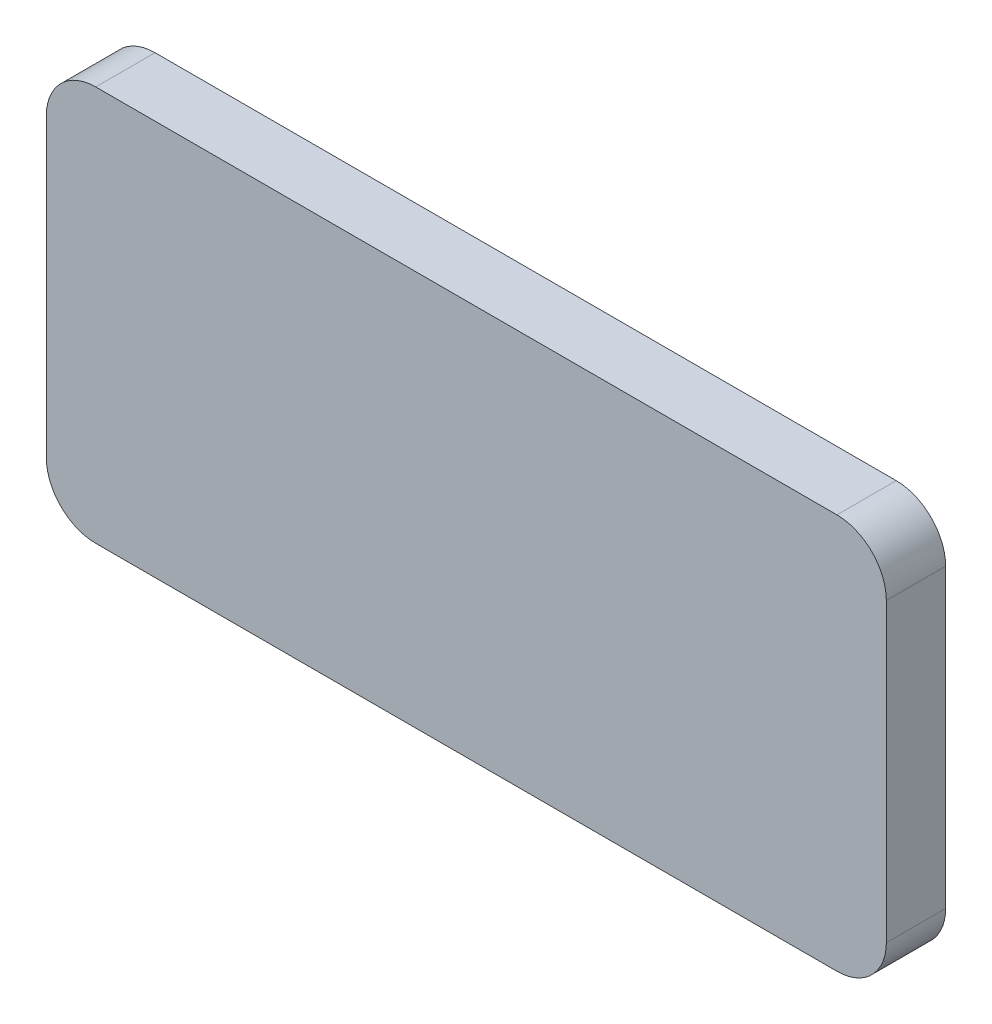
from build123d import *

# Parameters (mm, degrees)
ESQUISSE1_W                     = 85
ESQUISSE1_H                     = 40
BOSS_EXTRU_1_DEPTH              = 6
CONG_1_R                        = 5
ESQUISSE2_R                     = 4.5
BOSS_EXTRU_2_DEPTH              = 1
R_P_TITION_LIN_AIRE1_COUNT      = 7
R_P_TITION_LIN_AIRE1_PITCH      = 11
R_P_TITION_LIN_AIRE1_COUNT_DIR2 = 3
R_P_TITION_LIN_AIRE1_PITCH_DIR2 = 11
CONG_2_R                        = 5


with BuildPart() as part:
    # Esquisse1 → Boss.-Extru.1 (new body)
    with BuildSketch(Plane.XY):
        with Locations((42.5, 20)):
            Rectangle(ESQUISSE1_W, ESQUISSE1_H)
    extrude(amount=BOSS_EXTRU_1_DEPTH)

    # Congé1
    cong_1_edges = [part.edges().sort_by_distance(p)[0] for p in [
        (0, 40, 3),
        (85, 40, 3),
        (85, 0, 3),
        (0, 0, 3),
    ]]
    fillet(cong_1_edges, radius=CONG_1_R)

    # Esquisse2 → Boss.-Extru.2 (add)
    with BuildSketch(Plane(origin=(0, 0, 0), x_dir=(-1, 0, 0), z_dir=(0, 0, -1))):
        with Locations((-9, 31)):
            Circle(ESQUISSE2_R)
    boss_extru_2 = extrude(amount=BOSS_EXTRU_2_DEPTH)

    # Répétition linéaire1: Boss.-Extru.2 7 × 3
    with Locations(*[(i * R_P_TITION_LIN_AIRE1_PITCH, -j * R_P_TITION_LIN_AIRE1_PITCH_DIR2, 0) for i in range(R_P_TITION_LIN_AIRE1_COUNT) for j in range(R_P_TITION_LIN_AIRE1_COUNT_DIR2) if (i, j) != (0, 0)]):
        add(boss_extru_2)

    # Congé2
    # the kernel refuses this fillet: 5 mm, written as the material it takes off along each edge
    with BuildSketch(Plane(origin=(9, 31, -1), x_dir=(-1, 0, 0), z_dir=(0, -1, 0))) as cong_2_piece_1:
        with BuildLine():
            CenterArc((1.5, -5), CONG_2_R, 53.130102354, 36.869897646)
            Line((1.5, 0), (1.5, 0.1))
            Line((1.5, 0.1), (4.5, 0.1))
            Line((4.5, 0.1), (4.6, 0))
            ThreePointArc((4.6, 0), (4.6, -0.5), (4.56, -0.92))
            Line((4.56, -0.92), (4.5, -1))
        make_face()
    revolve(axis=Axis((9, 31, -1), (0, 0, -1)), mode=Mode.SUBTRACT)
    with BuildSketch(Plane(origin=(20, 20, -1), x_dir=(-1, 0, 0), z_dir=(0, -1, 0))) as cong_2_piece_2:
        with BuildLine():
            CenterArc((1.5, -5), CONG_2_R, 53.130102354, 36.869897646)
            Line((1.5, 0), (1.5, 0.1))
            Line((1.5, 0.1), (4.5, 0.1))
            Line((4.5, 0.1), (4.6, 0))
            ThreePointArc((4.6, 0), (4.6, -0.5), (4.56, -0.92))
            Line((4.56, -0.92), (4.5, -1))
        make_face()
    revolve(axis=Axis((20, 20, -1), (0, 0, -1)), mode=Mode.SUBTRACT)
    with BuildSketch(Plane(origin=(31, 20, -1), x_dir=(-1, 0, 0), z_dir=(0, -1, 0))) as cong_2_piece_3:
        with BuildLine():
            CenterArc((1.5, -5), CONG_2_R, 53.130102354, 36.869897646)
            Line((1.5, 0), (1.5, 0.1))
            Line((1.5, 0.1), (4.5, 0.1))
            Line((4.5, 0.1), (4.6, 0))
            ThreePointArc((4.6, 0), (4.6, -0.5), (4.56, -0.92))
            Line((4.56, -0.92), (4.5, -1))
        make_face()
    revolve(axis=Axis((31, 20, -1), (0, 0, -1)), mode=Mode.SUBTRACT)
    with BuildSketch(Plane(origin=(42, 20, -1), x_dir=(-1, 0, 0), z_dir=(0, -1, 0))) as cong_2_piece_4:
        with BuildLine():
            CenterArc((1.5, -5), CONG_2_R, 53.130102354, 36.869897646)
            Line((1.5, 0), (1.5, 0.1))
            Line((1.5, 0.1), (4.5, 0.1))
            Line((4.5, 0.1), (4.6, 0))
            ThreePointArc((4.6, 0), (4.6, -0.5), (4.56, -0.92))
            Line((4.56, -0.92), (4.5, -1))
        make_face()
    revolve(axis=Axis((42, 20, -1), (0, 0, -1)), mode=Mode.SUBTRACT)
    with BuildSketch(Plane(origin=(53, 20, -1), x_dir=(-1, 0, 0), z_dir=(0, -1, 0))) as cong_2_piece_5:
        with BuildLine():
            CenterArc((1.5, -5), CONG_2_R, 53.130102354, 36.869897646)
            Line((1.5, 0), (1.5, 0.1))
            Line((1.5, 0.1), (4.5, 0.1))
            Line((4.5, 0.1), (4.6, 0))
            ThreePointArc((4.6, 0), (4.6, -0.5), (4.56, -0.92))
            Line((4.56, -0.92), (4.5, -1))
        make_face()
    revolve(axis=Axis((53, 20, -1), (0, 0, -1)), mode=Mode.SUBTRACT)
    with BuildSketch(Plane(origin=(64, 20, -1), x_dir=(-1, 0, 0), z_dir=(0, -1, 0))) as cong_2_piece_6:
        with BuildLine():
            CenterArc((1.5, -5), CONG_2_R, 53.130102354, 36.869897646)
            Line((1.5, 0), (1.5, 0.1))
            Line((1.5, 0.1), (4.5, 0.1))
            Line((4.5, 0.1), (4.6, 0))
            ThreePointArc((4.6, 0), (4.6, -0.5), (4.56, -0.92))
            Line((4.56, -0.92), (4.5, -1))
        make_face()
    revolve(axis=Axis((64, 20, -1), (0, 0, -1)), mode=Mode.SUBTRACT)
    with BuildSketch(Plane(origin=(9, 20, -1), x_dir=(-1, 0, 0), z_dir=(0, -1, 0))) as cong_2_piece_7:
        with BuildLine():
            CenterArc((1.5, -5), CONG_2_R, 53.130102354, 36.869897646)
            Line((1.5, 0), (1.5, 0.1))
            Line((1.5, 0.1), (4.5, 0.1))
            Line((4.5, 0.1), (4.6, 0))
            ThreePointArc((4.6, 0), (4.6, -0.5), (4.56, -0.92))
            Line((4.56, -0.92), (4.5, -1))
        make_face()
    revolve(axis=Axis((9, 20, -1), (0, 0, -1)), mode=Mode.SUBTRACT)
    with BuildSketch(Plane(origin=(9, 9, -1), x_dir=(-1, 0, 0), z_dir=(0, -1, 0))) as cong_2_piece_8:
        with BuildLine():
            CenterArc((1.5, -5), CONG_2_R, 53.130102354, 36.869897646)
            Line((1.5, 0), (1.5, 0.1))
            Line((1.5, 0.1), (4.5, 0.1))
            Line((4.5, 0.1), (4.6, 0))
            ThreePointArc((4.6, 0), (4.6, -0.5), (4.56, -0.92))
            Line((4.56, -0.92), (4.5, -1))
        make_face()
    revolve(axis=Axis((9, 9, -1), (0, 0, -1)), mode=Mode.SUBTRACT)
    with BuildSketch(Plane(origin=(20, 31, -1), x_dir=(-1, 0, 0), z_dir=(0, -1, 0))) as cong_2_piece_9:
        with BuildLine():
            CenterArc((1.5, -5), CONG_2_R, 53.130102354, 36.869897646)
            Line((1.5, 0), (1.5, 0.1))
            Line((1.5, 0.1), (4.5, 0.1))
            Line((4.5, 0.1), (4.6, 0))
            ThreePointArc((4.6, 0), (4.6, -0.5), (4.56, -0.92))
            Line((4.56, -0.92), (4.5, -1))
        make_face()
    revolve(axis=Axis((20, 31, -1), (0, 0, -1)), mode=Mode.SUBTRACT)
    with BuildSketch(Plane(origin=(20, 9, -1), x_dir=(-1, 0, 0), z_dir=(0, -1, 0))) as cong_2_piece_10:
        with BuildLine():
            CenterArc((1.5, -5), CONG_2_R, 53.130102354, 36.869897646)
            Line((1.5, 0), (1.5, 0.1))
            Line((1.5, 0.1), (4.5, 0.1))
            Line((4.5, 0.1), (4.6, 0))
            ThreePointArc((4.6, 0), (4.6, -0.5), (4.56, -0.92))
            Line((4.56, -0.92), (4.5, -1))
        make_face()
    revolve(axis=Axis((20, 9, -1), (0, 0, -1)), mode=Mode.SUBTRACT)
    with BuildSketch(Plane(origin=(31, 31, -1), x_dir=(-1, 0, 0), z_dir=(0, -1, 0))) as cong_2_piece_11:
        with BuildLine():
            CenterArc((1.5, -5), CONG_2_R, 53.130102354, 36.869897646)
            Line((1.5, 0), (1.5, 0.1))
            Line((1.5, 0.1), (4.5, 0.1))
            Line((4.5, 0.1), (4.6, 0))
            ThreePointArc((4.6, 0), (4.6, -0.5), (4.56, -0.92))
            Line((4.56, -0.92), (4.5, -1))
        make_face()
    revolve(axis=Axis((31, 31, -1), (0, 0, -1)), mode=Mode.SUBTRACT)
    with BuildSketch(Plane(origin=(31, 9, -1), x_dir=(-1, 0, 0), z_dir=(0, -1, 0))) as cong_2_piece_12:
        with BuildLine():
            CenterArc((1.5, -5), CONG_2_R, 53.130102354, 36.869897646)
            Line((1.5, 0), (1.5, 0.1))
            Line((1.5, 0.1), (4.5, 0.1))
            Line((4.5, 0.1), (4.6, 0))
            ThreePointArc((4.6, 0), (4.6, -0.5), (4.56, -0.92))
            Line((4.56, -0.92), (4.5, -1))
        make_face()
    revolve(axis=Axis((31, 9, -1), (0, 0, -1)), mode=Mode.SUBTRACT)
    with BuildSketch(Plane(origin=(42, 31, -1), x_dir=(-1, 0, 0), z_dir=(0, -1, 0))) as cong_2_piece_13:
        with BuildLine():
            CenterArc((1.5, -5), CONG_2_R, 53.130102354, 36.869897646)
            Line((1.5, 0), (1.5, 0.1))
            Line((1.5, 0.1), (4.5, 0.1))
            Line((4.5, 0.1), (4.6, 0))
            ThreePointArc((4.6, 0), (4.6, -0.5), (4.56, -0.92))
            Line((4.56, -0.92), (4.5, -1))
        make_face()
    revolve(axis=Axis((42, 31, -1), (0, 0, -1)), mode=Mode.SUBTRACT)
    with BuildSketch(Plane(origin=(42, 9, -1), x_dir=(-1, 0, 0), z_dir=(0, -1, 0))) as cong_2_piece_14:
        with BuildLine():
            CenterArc((1.5, -5), CONG_2_R, 53.130102354, 36.869897646)
            Line((1.5, 0), (1.5, 0.1))
            Line((1.5, 0.1), (4.5, 0.1))
            Line((4.5, 0.1), (4.6, 0))
            ThreePointArc((4.6, 0), (4.6, -0.5), (4.56, -0.92))
            Line((4.56, -0.92), (4.5, -1))
        make_face()
    revolve(axis=Axis((42, 9, -1), (0, 0, -1)), mode=Mode.SUBTRACT)
    with BuildSketch(Plane(origin=(53, 31, -1), x_dir=(-1, 0, 0), z_dir=(0, -1, 0))) as cong_2_piece_15:
        with BuildLine():
            CenterArc((1.5, -5), CONG_2_R, 53.130102354, 36.869897646)
            Line((1.5, 0), (1.5, 0.1))
            Line((1.5, 0.1), (4.5, 0.1))
            Line((4.5, 0.1), (4.6, 0))
            ThreePointArc((4.6, 0), (4.6, -0.5), (4.56, -0.92))
            Line((4.56, -0.92), (4.5, -1))
        make_face()
    revolve(axis=Axis((53, 31, -1), (0, 0, -1)), mode=Mode.SUBTRACT)
    with BuildSketch(Plane(origin=(53, 9, -1), x_dir=(-1, 0, 0), z_dir=(0, -1, 0))) as cong_2_piece_16:
        with BuildLine():
            CenterArc((1.5, -5), CONG_2_R, 53.130102354, 36.869897646)
            Line((1.5, 0), (1.5, 0.1))
            Line((1.5, 0.1), (4.5, 0.1))
            Line((4.5, 0.1), (4.6, 0))
            ThreePointArc((4.6, 0), (4.6, -0.5), (4.56, -0.92))
            Line((4.56, -0.92), (4.5, -1))
        make_face()
    revolve(axis=Axis((53, 9, -1), (0, 0, -1)), mode=Mode.SUBTRACT)
    with BuildSketch(Plane(origin=(64, 31, -1), x_dir=(-1, 0, 0), z_dir=(0, -1, 0))) as cong_2_piece_17:
        with BuildLine():
            CenterArc((1.5, -5), CONG_2_R, 53.130102354, 36.869897646)
            Line((1.5, 0), (1.5, 0.1))
            Line((1.5, 0.1), (4.5, 0.1))
            Line((4.5, 0.1), (4.6, 0))
            ThreePointArc((4.6, 0), (4.6, -0.5), (4.56, -0.92))
            Line((4.56, -0.92), (4.5, -1))
        make_face()
    revolve(axis=Axis((64, 31, -1), (0, 0, -1)), mode=Mode.SUBTRACT)
    with BuildSketch(Plane(origin=(64, 9, -1), x_dir=(-1, 0, 0), z_dir=(0, -1, 0))) as cong_2_piece_18:
        with BuildLine():
            CenterArc((1.5, -5), CONG_2_R, 53.130102354, 36.869897646)
            Line((1.5, 0), (1.5, 0.1))
            Line((1.5, 0.1), (4.5, 0.1))
            Line((4.5, 0.1), (4.6, 0))
            ThreePointArc((4.6, 0), (4.6, -0.5), (4.56, -0.92))
            Line((4.56, -0.92), (4.5, -1))
        make_face()
    revolve(axis=Axis((64, 9, -1), (0, 0, -1)), mode=Mode.SUBTRACT)
    with BuildSketch(Plane(origin=(75, 31, -1), x_dir=(-1, 0, 0), z_dir=(0, -1, 0))) as cong_2_piece_19:
        with BuildLine():
            CenterArc((1.5, -5), CONG_2_R, 53.130102354, 36.869897646)
            Line((1.5, 0), (1.5, 0.1))
            Line((1.5, 0.1), (4.5, 0.1))
            Line((4.5, 0.1), (4.6, 0))
            ThreePointArc((4.6, 0), (4.6, -0.5), (4.56, -0.92))
            Line((4.56, -0.92), (4.5, -1))
        make_face()
    revolve(axis=Axis((75, 31, -1), (0, 0, -1)), mode=Mode.SUBTRACT)
    with BuildSketch(Plane(origin=(75, 20, -1), x_dir=(-1, 0, 0), z_dir=(0, -1, 0))) as cong_2_piece_20:
        with BuildLine():
            CenterArc((1.5, -5), CONG_2_R, 53.130102354, 36.869897646)
            Line((1.5, 0), (1.5, 0.1))
            Line((1.5, 0.1), (4.5, 0.1))
            Line((4.5, 0.1), (4.6, 0))
            ThreePointArc((4.6, 0), (4.6, -0.5), (4.56, -0.92))
            Line((4.56, -0.92), (4.5, -1))
        make_face()
    revolve(axis=Axis((75, 20, -1), (0, 0, -1)), mode=Mode.SUBTRACT)
    with BuildSketch(Plane(origin=(75, 9, -1), x_dir=(-1, 0, 0), z_dir=(0, -1, 0))) as cong_2_piece_21:
        with BuildLine():
            CenterArc((1.5, -5), CONG_2_R, 53.130102354, 36.869897646)
            Line((1.5, 0), (1.5, 0.1))
            Line((1.5, 0.1), (4.5, 0.1))
            Line((4.5, 0.1), (4.6, 0))
            ThreePointArc((4.6, 0), (4.6, -0.5), (4.56, -0.92))
            Line((4.56, -0.92), (4.5, -1))
        make_face()
    revolve(axis=Axis((75, 9, -1), (0, 0, -1)), mode=Mode.SUBTRACT)


solid = part.part
